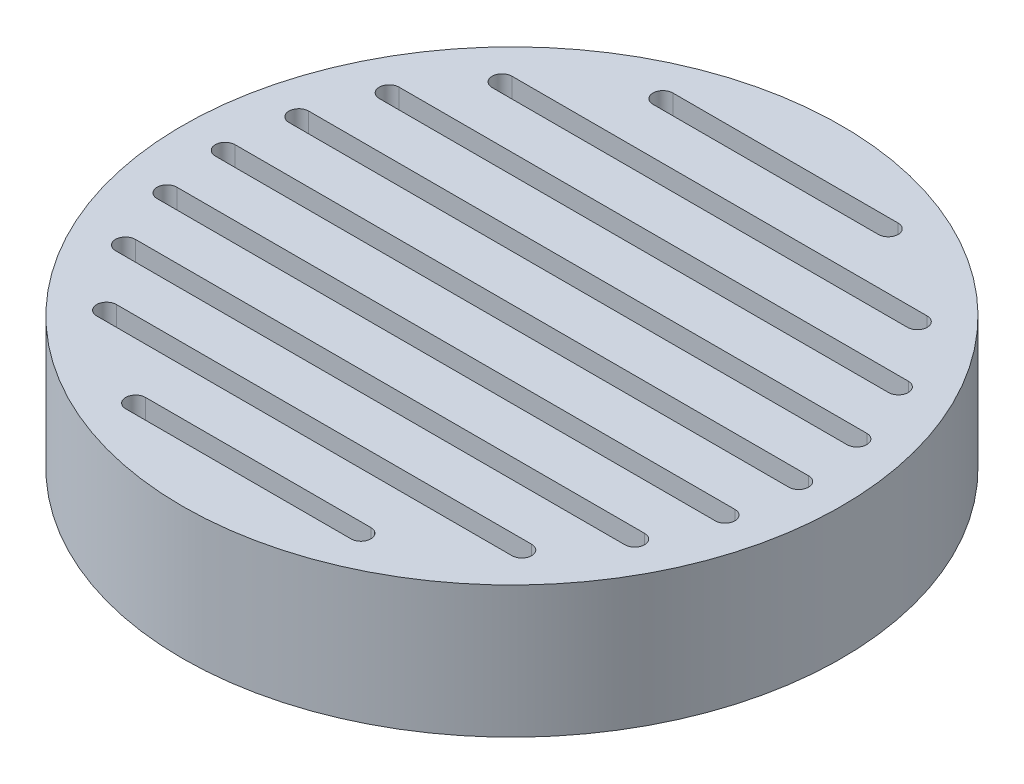
from build123d import *

# Parameters (mm, degrees)
SKETCH_3_R             = 50
EXTRUDE_2_DEPTH        = 20
CUT_EXTRUDE_2_DEPTH    = 74.484692283
PATTERN_LINEAR_2_DEPTH = 20


# Read off the part's stored shape, not the designer's step: 阵列(线性)2
with BuildPart() as part:
    # 草图3 → 凸台-拉伸2 (new body)
    with BuildSketch(Plane(origin=(0, 0, 0), x_dir=(1, 0, 0), z_dir=(0, 1, 0))):
        with Locations(Location((0, 0, 0), (0, 0, 270))):
            Circle(SKETCH_3_R)
    extrude(amount=EXTRUDE_2_DEPTH)

    # 草图4 → 切除-拉伸2 (cut, through all)
    with BuildSketch(Plane(origin=(0, 20, 0), x_dir=(1, 0, 0), z_dir=(0, 1, 0))):
        with BuildLine():
            Line((-17.095320997, -38.5), (17.095320997, -38.5))
            ThreePointArc((17.095320997, -38.5), (18.595320997, -40), (17.095320997, -41.5))
            Line((17.095320997, -41.5), (-17.095320997, -41.5))
            ThreePointArc((-17.095320997, -41.5), (-18.595320997, -40), (-17.095320997, -38.5))
        make_face()
    extrude(amount=-CUT_EXTRUDE_2_DEPTH, mode=Mode.SUBTRACT)

    # 阵列(线性)2 outline → 阵列(线性)2 (cut)
    with BuildSketch(Plane(origin=(0, 0, 0), x_dir=(1, 0, 0), z_dir=(0, 1, 0))):
        with BuildLine():
            Line((17.095320997, 41.5), (-17.095320997, 41.5))
            ThreePointArc((-17.095320997, 41.5), (-18.595320997, 40), (-17.095320997, 38.5))
            Line((-17.095320997, 38.5), (17.095320997, 38.5))
            ThreePointArc((17.095320997, 38.5), (18.595320997, 40), (17.095320997, 41.5))
        make_face()
        with BuildLine():
            Line((31.5, 31.5), (-31.5, 31.5))
            ThreePointArc((-31.5, 31.5), (-33, 30), (-31.5, 28.5))
            Line((-31.5, 28.5), (31.5, 28.5))
            ThreePointArc((31.5, 28.5), (33, 30), (31.5, 31.5))
        make_face()
        with BuildLine():
            Line((38.629651823, 21.5), (-38.629651823, 21.5))
            ThreePointArc((-38.629651823, 21.5), (-40.129651823, 20), (-38.629651823, 18.5))
            Line((-38.629651823, 18.5), (38.629651823, 18.5))
            ThreePointArc((38.629651823, 18.5), (40.129651823, 20), (38.629651823, 21.5))
        make_face()
        with BuildLine():
            Line((42.334973721, 11.5), (-42.334973721, 11.5))
            ThreePointArc((-42.334973721, 11.5), (-43.834973721, 10), (-42.334973721, 8.5))
            Line((-42.334973721, 8.5), (42.334973721, 8.5))
            ThreePointArc((42.334973721, 8.5), (43.834973721, 10), (42.334973721, 11.5))
        make_face()
        with BuildLine():
            Line((43.5, 1.5), (-43.5, 1.5))
            ThreePointArc((-43.5, 1.5), (-45, 0), (-43.5, -1.5))
            Line((-43.5, -1.5), (43.5, -1.5))
            ThreePointArc((43.5, -1.5), (45, 0), (43.5, 1.5))
        make_face()
        with BuildLine():
            Line((42.334973721, -8.5), (-42.334973721, -8.5))
            ThreePointArc((-42.334973721, -8.5), (-43.834973721, -10), (-42.334973721, -11.5))
            Line((-42.334973721, -11.5), (42.334973721, -11.5))
            ThreePointArc((42.334973721, -11.5), (43.834973721, -10), (42.334973721, -8.5))
        make_face()
        with BuildLine():
            Line((38.629651823, -18.5), (-38.629651823, -18.5))
            ThreePointArc((-38.629651823, -18.5), (-40.129651823, -20), (-38.629651823, -21.5))
            Line((-38.629651823, -21.5), (38.629651823, -21.5))
            ThreePointArc((38.629651823, -21.5), (40.129651823, -20), (38.629651823, -18.5))
        make_face()
        with BuildLine():
            Line((31.5, -28.5), (-31.5, -28.5))
            ThreePointArc((-31.5, -28.5), (-33, -30), (-31.5, -31.5))
            Line((-31.5, -31.5), (31.5, -31.5))
            ThreePointArc((31.5, -31.5), (33, -30), (31.5, -28.5))
        make_face()
    extrude(amount=PATTERN_LINEAR_2_DEPTH, mode=Mode.SUBTRACT)


solid = part.part
